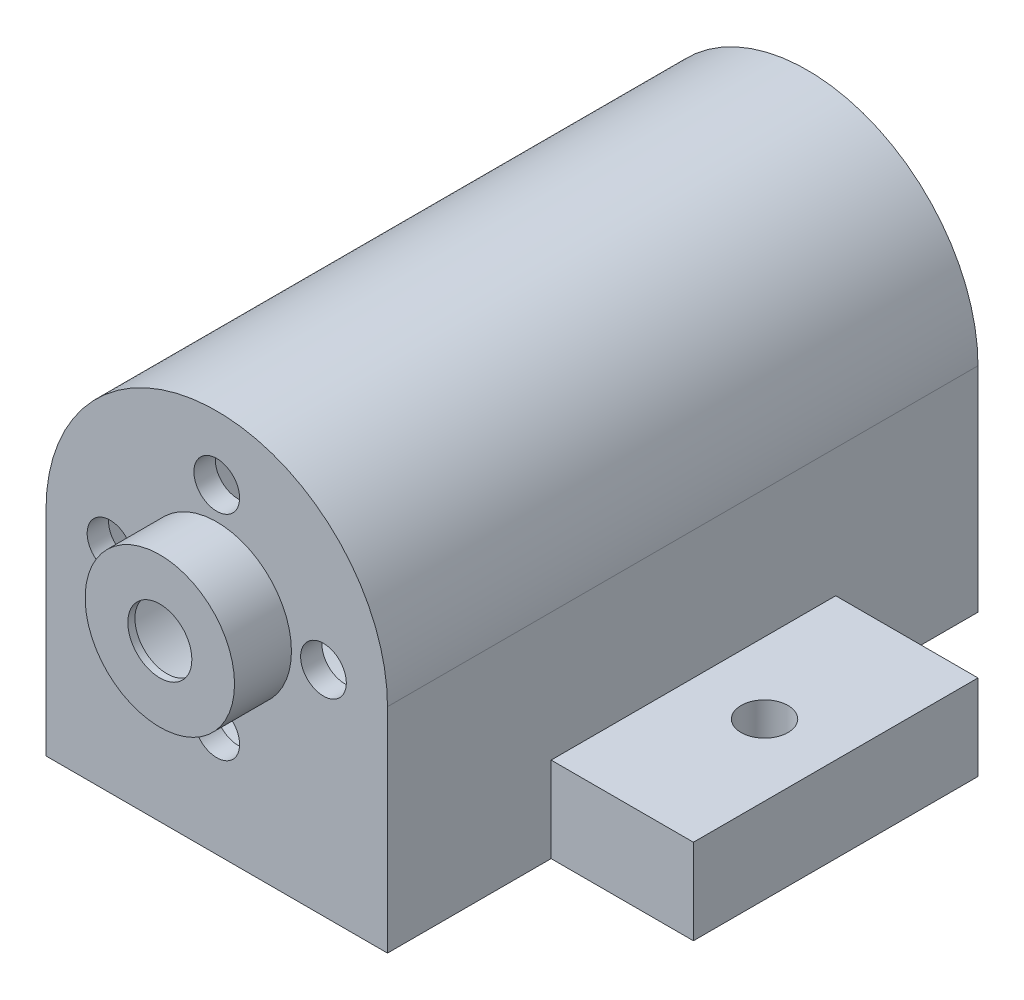
from build123d import *
from build123d.topology import SkipClean

# Parameters (mm, degrees)
CROQUIS1_R              = 12
SALIENTE_EXTRUIR1_DEPTH = 1.5
CROQUIS2_R              = 1.606590309
CORTAR_EXTRUIR1_DEPTH   = 2
CROQUIS3_R              = 5.25
SALIENTE_EXTRUIR2_DEPTH = 4
CROQUIS4_R              = 5.1
CORTAR_EXTRUIR2_DEPTH   = 5
CROQUIS5_R              = 2.25
CORTAR_EXTRUIR3_DEPTH   = 5
SALIENTE_EXTRUIR3_START = 40
CROQUIS7_R              = 12
CROQUIS7_R_2            = 11.25
SALIENTE_EXTRUIR3_DEPTH = 40
SALIENTE_EXTRUIR4_DEPTH = 41.5
CROQUIS9_W              = 20
CROQUIS9_H              = 6
SALIENTE_EXTRUIR5_DEPTH = 10
CROQUIS10_W             = 20
CROQUIS10_H             = 6
SALIENTE_EXTRUIR6_DEPTH = 10
CROQUIS11_R             = 1.65
CORTAR_EXTRUIR4_DEPTH   = 10


with BuildPart() as part:
    # Croquis1 → Saliente-Extruir1 (new body)
    with BuildSketch(Plane.XY):
        with Locations((-728.422782565, 1.40916901)):
            Circle(CROQUIS1_R)
    extrude(amount=SALIENTE_EXTRUIR1_DEPTH)

    # Croquis2 → Cortar-Extruir1 (cut)
    with BuildSketch(Plane.XY.offset(1.5)):
        with Locations((-728.422782565, 8.90916901)):
            Circle(CROQUIS2_R)
        with Locations((-720.922782565, 1.40916901)):
            Circle(CROQUIS2_R)
        with Locations((-728.422782565, -6.09083099)):
            Circle(CROQUIS2_R)
        with Locations((-735.922782565, 1.40916901)):
            Circle(CROQUIS2_R)
    extrude(amount=-CORTAR_EXTRUIR1_DEPTH, mode=Mode.SUBTRACT)

    # Croquis3 → Saliente-Extruir2 (add)
    with BuildSketch(Plane.XY.offset(1.5)):
        with Locations((-728.422782565, 1.40916901)):
            Circle(CROQUIS3_R)
    extrude(amount=SALIENTE_EXTRUIR2_DEPTH)

    # Croquis4 → Cortar-Extruir2 (cut)
    with BuildSketch(Plane(origin=(0, 0, 0), x_dir=(-1, 0, 0), z_dir=(0, 0, -1))):
        with Locations((728.422782565, 1.40916901)):
            Circle(CROQUIS4_R)
    extrude(amount=-CORTAR_EXTRUIR2_DEPTH, mode=Mode.SUBTRACT)

    # Croquis5 → Cortar-Extruir3 (cut)
    with BuildSketch(Plane.XY.offset(5.5)):
        with Locations((-728.422782565, 1.40916901)):
            Circle(CROQUIS5_R)
    extrude(amount=-CORTAR_EXTRUIR3_DEPTH, mode=Mode.SUBTRACT)

    # Croquis7 → Saliente-Extruir3 (add)
    with BuildSketch(Plane(origin=(0, 0, 0), x_dir=(-1, 0, 0), z_dir=(0, 0, -1)).offset(SALIENTE_EXTRUIR3_START)):
        with Locations((728.422782565, 1.40916901)):
            Circle(CROQUIS7_R)
        with Locations((728.422782565, 1.40916901)):
            Circle(CROQUIS7_R_2, mode=Mode.SUBTRACT)
    extrude(amount=-SALIENTE_EXTRUIR3_DEPTH)

    # Croquis8 → Saliente-Extruir4 (add)
    with SkipClean():  # the faces are left unmerged after this step: merging them gives an invalid solid
        with BuildSketch(Plane(origin=(0, 0, -40), x_dir=(-1, 0, 0), z_dir=(0, 0, -1))):
            with BuildLine():
                Line((716.422782565, 1.40916901), (716.422782565, -13.59083099))
                Line((716.422782565, -13.59083099), (728.422782565, -13.59083099))
                Line((728.422782565, -13.59083099), (740.422782565, -13.59083099))
                Line((740.422782565, -13.59083099), (740.422782565, 1.40916901))
                ThreePointArc((740.422782565, 1.40916901), (728.422782565, -10.59083099), (716.422782565, 1.40916901))
            make_face()
        extrude(amount=-SALIENTE_EXTRUIR4_DEPTH)
    add(part.part.scale(1), mode=Mode.REPLACE)  # the faces are merged on a copy

    # Croquis9 → Saliente-Extruir5 (add)
    with BuildSketch(Plane.ZY.offset(740.422782565)):
        with Locations((-20, -10.59083099)):
            Rectangle(CROQUIS9_W, CROQUIS9_H)
    extrude(amount=SALIENTE_EXTRUIR5_DEPTH)

    # Croquis10 → Saliente-Extruir6 (add)
    with BuildSketch(Plane(origin=(-716.422782565, 0, 0), x_dir=(0, 0, -1), z_dir=(1, 0, 0))):
        with Locations((20, -10.59083099)):
            Rectangle(CROQUIS10_W, CROQUIS10_H)
    extrude(amount=SALIENTE_EXTRUIR6_DEPTH)

    # Croquis11 → Cortar-Extruir4 (cut)
    with BuildSketch(Plane(origin=(0, -7.59083099, 0), x_dir=(1, 0, 0), z_dir=(0, 1, 0))):
        with Locations((-745.422782565, 20)):
            Circle(CROQUIS11_R)
        with Locations((-711.422782565, 20)):
            Circle(CROQUIS11_R)
    extrude(amount=-CORTAR_EXTRUIR4_DEPTH, mode=Mode.SUBTRACT)


solid = part.part
